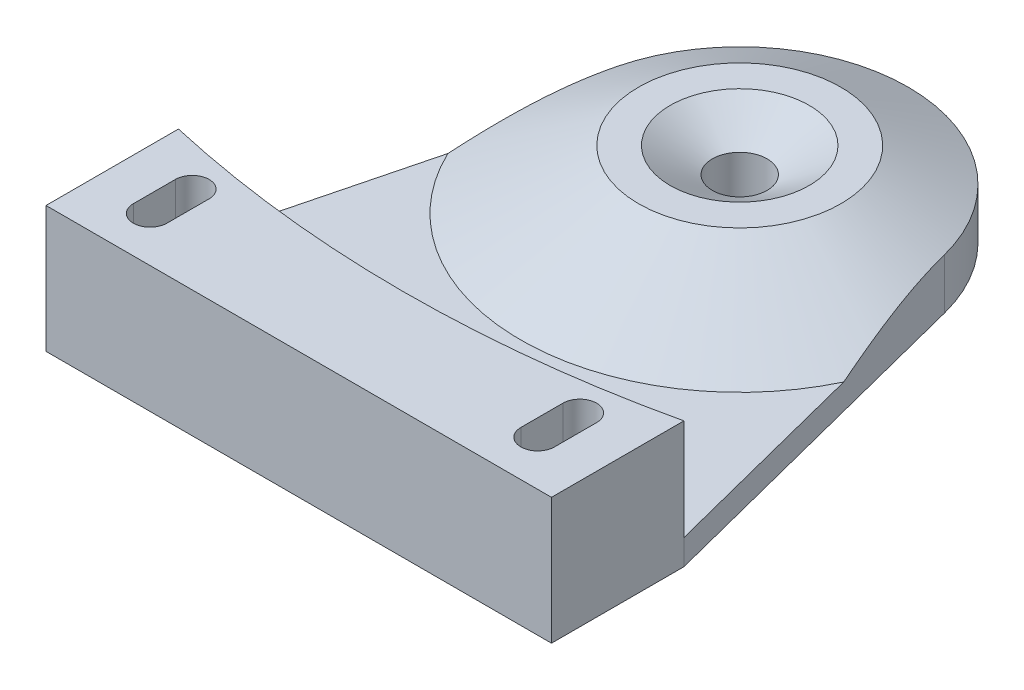
from build123d import *

# Parameters (mm, degrees)
BOSS_EXTRUDE1_DEPTH    = 15
BOSS_EXTRUDE2_DEPTH    = 10
SKETCH3_R              = 3.25
CUT_EXTRUDE1_DEPTH     = 9
CUT_EXTRUDE2_START     = -7
SKETCH4_R              = 6
CUT_EXTRUDE2_DEPTH     = 7
CHAMFER1_START         = 3
CHAMFER1_2_DEPTH       = 7
CHAMFER1_3_OUTLINE_R   = 12
CHAMFER1_3_OUTLINE_R_2 = 6
CHAMFER1_3_DEPTH       = 7
CHAMFER2_SIZE          = 5
CHAMFER2_SIZE2         = 3


with BuildPart() as part:
    # Sketch1 → Boss-Extrude1 (new body)
    with BuildSketch(Plane(origin=(0, 0, 0), x_dir=(1, 0, 0), z_dir=(0, 1, 0))):
        with BuildLine():
            Line((-30, -388.070415552), (30, -388.070415552))
            Line((30, -388.070415552), (30, -372.350901436))
            ThreePointArc((30, -372.350901436), (0, -375.726435625), (-30, -372.350901436))
            Line((-30, -372.350901436), (-30, -388.070415552))
        make_face()
        with BuildLine():
            Line((-21, -382.710658494), (-21, -377.710658494))
            ThreePointArc((-21, -377.710658494), (-23, -375.710658494), (-25, -377.710658494))
            Line((-25, -377.710658494), (-25, -382.710658494))
            ThreePointArc((-25, -382.710658494), (-23, -384.710658494), (-21, -382.710658494))
        make_face(mode=Mode.SUBTRACT)
        with BuildLine():
            Line((25, -377.710658494), (25, -382.710658494))
            ThreePointArc((25, -382.710658494), (23, -384.710658494), (21, -382.710658494))
            Line((21, -382.710658494), (21, -377.710658494))
            ThreePointArc((21, -377.710658494), (23, -375.710658494), (25, -377.710658494))
        make_face(mode=Mode.SUBTRACT)
    extrude(amount=BOSS_EXTRUDE1_DEPTH)

    # Sketch2 → Boss-Extrude2 (add)
    with BuildSketch(Plane(origin=(0, 0, 0), x_dir=(1, 0, 0), z_dir=(0, 1, 0))):
        with BuildLine():
            Line((30, -372.350901436), (19.377517729, -330.775495649))
            ThreePointArc((19.377517729, -330.775495649), (0, -315.726435625), (-19.377517729, -330.775495649))
            Line((-19.377517729, -330.775495649), (-30, -372.350901436))
            ThreePointArc((-30, -372.350901436), (0, -375.726435625), (30, -372.350901436))
        make_face()
    extrude(amount=BOSS_EXTRUDE2_DEPTH)

    # Sketch3 → Cut-Extrude1 (cut)
    with BuildSketch(Plane(origin=(0, 10, 0), x_dir=(1, 0, 0), z_dir=(0, 1, 0))):
        with Locations(Location((0, -335.726435625, 0), (0, 0, 270))):
            Circle(SKETCH3_R)
    extrude(amount=-CUT_EXTRUDE1_DEPTH, mode=Mode.SUBTRACT)

    # Sketch4 → Cut-Extrude2 (cut)
    with BuildSketch(Plane(origin=(0, 10, 0), x_dir=(1, 0, 0), z_dir=(0, 1, 0)).offset(CUT_EXTRUDE2_START)):
        with BuildLine():
            Line((30, -372.350901436), (19.377517729, -330.775495649))
            ThreePointArc((19.377517729, -330.775495649), (0, -315.726435625), (-19.377517729, -330.775495649))
            Line((-19.377517729, -330.775495649), (-30, -372.350901436))
            ThreePointArc((-30, -372.350901436), (0, -375.726435625), (30, -372.350901436))
        make_face()
        with Locations(Location((0, -335.726435625, 0), (0, 0, 270))):
            Circle(SKETCH4_R, mode=Mode.SUBTRACT)
    extrude(amount=CUT_EXTRUDE2_DEPTH, mode=Mode.SUBTRACT)

    # Chamfer1: read off the stored shape, not the designer's step
    # Chamfer1 outline → Chamfer1 (revolve)
    with BuildSketch(Plane.XY.offset(335.726435625)):
        Polygon((26, 3), (12, 10), (12, 3), align=None)
    revolve(axis=Axis((0, 0, 335.726435625), (0, 1, 0)))

    # Chamfer1 2 outline → Chamfer1 2 (cut)
    with BuildSketch(Plane(origin=(0, 0, 0), x_dir=(1, 0, 0), z_dir=(0, 1, 0)).offset(CHAMFER1_START)):
        with BuildLine():
            ThreePointArc((-19.377517729, -330.775495649), (0, -315.726435625), (19.377517729, -330.775495649))
            Line((19.377517729, -330.775495649), (24.033863727, -349))
            Line((24.033863727, -349), (27, -349))
            Line((27, -349), (27, -308))
            Line((27, -308), (-27, -308))
            Line((-27, -308), (-27, -349))
            Line((-27, -349), (-24.033863727, -349))
            Line((-24.033863727, -349), (-19.377517729, -330.775495649))
        make_face()
    extrude(amount=CHAMFER1_2_DEPTH, mode=Mode.SUBTRACT)

    # Chamfer1 3 outline → Chamfer1 3 (add)
    with BuildSketch(Plane(origin=(0, 0, 0), x_dir=(1, 0, 0), z_dir=(0, 1, 0)).offset(CHAMFER1_START)):
        with Locations((0, -335.726435625)):
            Circle(CHAMFER1_3_OUTLINE_R)
        with Locations((0, -335.726435625)):
            Circle(CHAMFER1_3_OUTLINE_R_2, mode=Mode.SUBTRACT)
    extrude(amount=CHAMFER1_3_DEPTH)

    # Chamfer2
    chamfer2_edges = [part.edges().sort_by_distance(p)[0] for p in [
        (0, 10, 332.476435625),
    ]]
    chamfer2_side = [part.faces().sort_by_distance(p)[0] for p in [
        (-11.660588745, 10, 335.726435625),
    ]]
    chamfer(chamfer2_edges, length=CHAMFER2_SIZE, length2=CHAMFER2_SIZE2, reference=chamfer2_side[0])


solid = part.part
